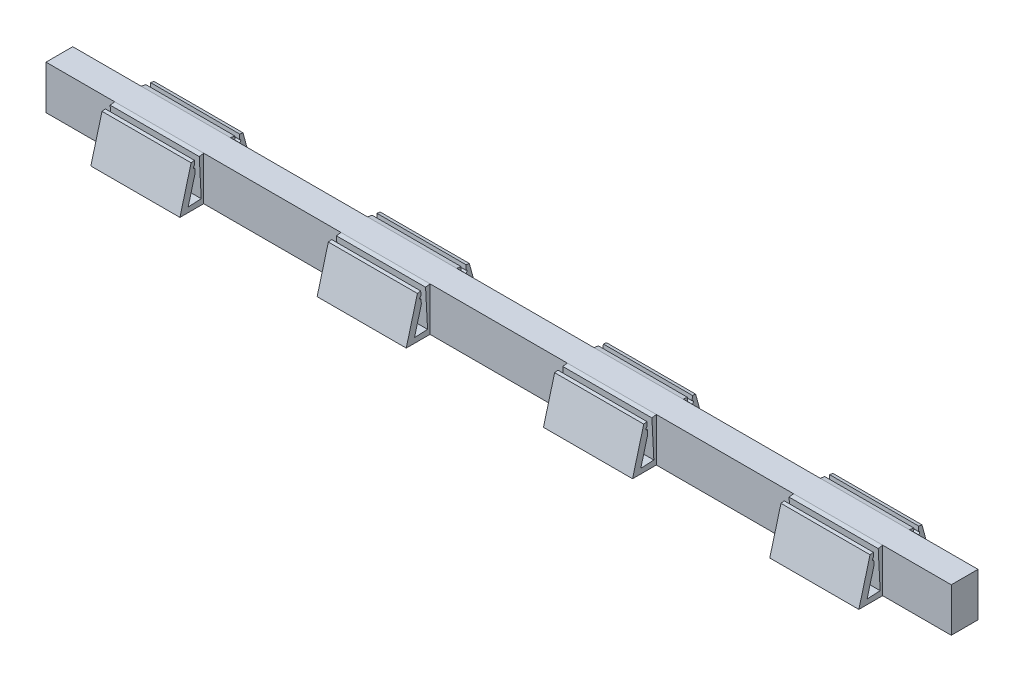
from build123d import *

# Parameters (mm, degrees)
CLIP_1_DEPTH           = 10
CENTER_BEAM_DEPTH      = 177.8
CENTER_BEAM_DEPTH_BACK = 25.4
SKETCH4_W              = 6.003992509
SKETCH4_H              = 9.824299843
LPATTERN1_COUNT        = 4
LPATTERN1_PITCH        = 50.8


with BuildPart() as part:
    # Sketch1 → Clip #1 (new, symmetric)
    with BuildSketch(Plane(origin=(0, 0, 0), x_dir=(0, 0, -1), z_dir=(1, 0, 0))):
        with BuildLine():
            Line((6.081551938, 6.841542851), (7.61911384, 1.103283712))
            Line((7.61911384, 1.103283712), (4.687365208, 1.256930148))
            Line((4.687365208, 1.256930148), (5.127959845, 9.663976652))
            Line((5.127959845, 9.663976652), (4.1299561, 9.824299843))
            Line((4.1299561, 9.824299843), (-1.874036409, 9.824299843))
            Line((-1.874036409, 9.824299843), (-2.872040155, 9.663976652))
            Line((-2.872040155, 9.663976652), (-2.431445517, 1.256930148))
            Line((-2.431445517, 1.256930148), (-5.36319415, 1.103283712))
            Line((-5.36319415, 1.103283712), (-3.825632248, 6.841542851))
            Line((-3.825632248, 6.841542851), (-3.879292118, 7.86543416))
            ThreePointArc((-3.879292118, 7.86543416), (-4.194581765, 8.149322234), (-3.910693691, 8.464611881))
            Line((-3.910693691, 8.464611881), (-3.964353561, 9.488503191))
            Line((-3.964353561, 9.488503191), (-4.701004321, 9.370164756))
            Line((-4.701004321, 9.370164756), (-7.2117324, 0))
            Line((-7.2117324, 0), (-2.365572599, 0))
            Line((-2.365572599, 0), (4.62149229, 0))
            Line((4.62149229, 0), (9.46765209, 0))
            Line((9.46765209, 0), (6.956924011, 9.370164756))
            Line((6.956924011, 9.370164756), (6.220273251, 9.488503191))
            Line((6.220273251, 9.488503191), (6.166613382, 8.464611881))
            ThreePointArc((6.166613382, 8.464611881), (6.450501455, 8.149322234), (6.135211808, 7.86543416))
            Line((6.135211808, 7.86543416), (6.081551938, 6.841542851))
        make_face()
    clip_1 = extrude(amount=CLIP_1_DEPTH, both=True)

    # Sketch4 → Center beam (add, two sides: drawn at the far end of the back side and taken through both)
    with BuildSketch(Plane(origin=(0, 0, 0), x_dir=(0, 0, -1), z_dir=(1, 0, 0)).offset(-CENTER_BEAM_DEPTH_BACK)):
        with Locations((1.127959845, 4.912149922)):
            Rectangle(SKETCH4_W, SKETCH4_H)
    extrude(amount=CENTER_BEAM_DEPTH + CENTER_BEAM_DEPTH_BACK)

    # LPattern1: Clip #1 ×4
    with Locations(*[(i * LPATTERN1_PITCH, 0, 0) for i in range(1, LPATTERN1_COUNT)]):
        add(clip_1)


solid = part.part
